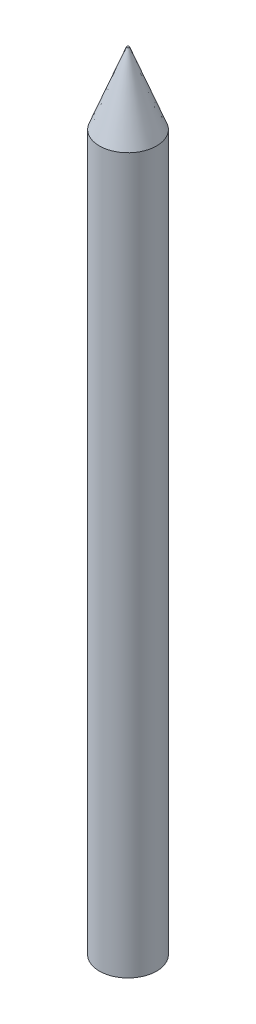
from build123d import *

# Parameters (mm, degrees)
SKETCH1_R           = 2
BOSS_EXTRUDE1_DEPTH = 50


with BuildPart() as part:
    # Sketch1 → Boss-Extrude1 (new body)
    with BuildSketch(Plane(origin=(0, 0, 0), x_dir=(1, 0, 0), z_dir=(0, 1, 0))):
        Circle(SKETCH1_R)
    extrude(amount=BOSS_EXTRUDE1_DEPTH)

    # Sketch2 → Revolve1 (revolve)
    with BuildSketch(Plane.XY):
        Polygon((0, 55), (0, 50), (2, 50), (0.078528032, 55), align=None)
    revolve(axis=Axis((0, 55, 0), (0, -1, 0)))


solid = part.part
